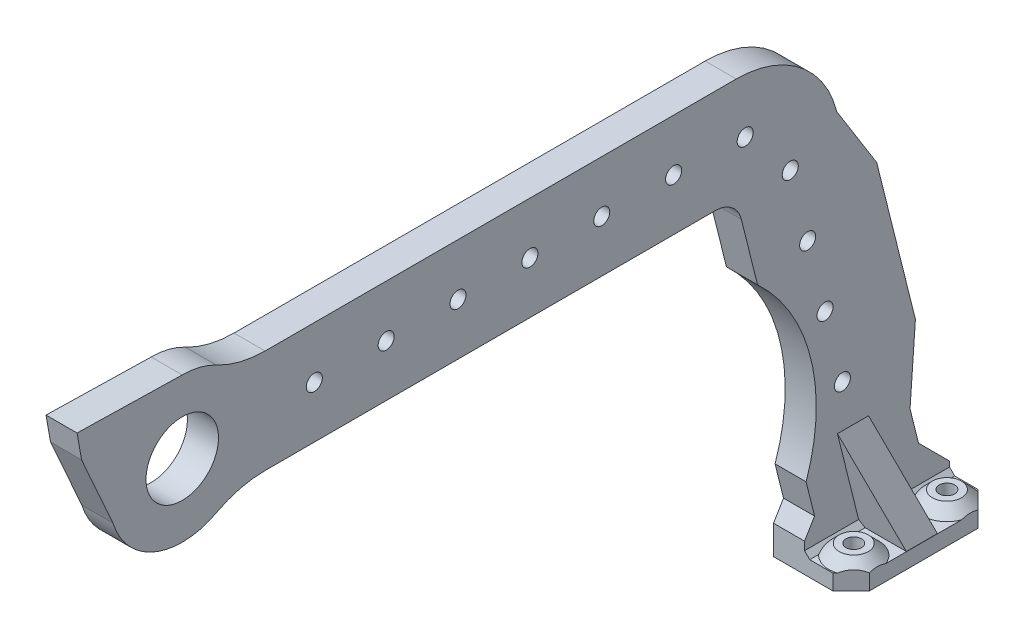
from build123d import *

# Parameters (mm, degrees)
SKETCH_1_R                = 7
EXTRUDE_1_DEPTH           = 3
SKETCH_5_W                = 15
SKETCH_5_H                = 28
EXTRUDE_3_DEPTH           = 3
SKETCH_6_R                = 1.5
CUT_EXTRUDE_2_DEPTH       = 175.055428478
CHAMFER_1_SIZE            = 3.5
SKETCH_10_R               = 1.55
CUT_EXTRUDE_3_DEPTH       = 10
PATTERN_START             = -3
PATTERN_CURVE_1_OUTLINE_R = 1.55
PATTERN_CURVE_1_DEPTH     = 6
EXTRUDE_4_DEPTH           = 6
EXTRUDE_5_DEPTH           = 3
CHAMFER_2_SIZE            = 1
CHAMFER_3_SIZE            = 4.949606318
CHAMFER_3_SIZE_2          = 6
CHAMFER_3_SIZE_3          = 8.237528241
EXTRUDE_START             = 2
SKETCH_17_R               = 2.8
SKETCH_17_R_2             = 1.5
EXTRUDE_1_2_DEPTH         = 2
CHAMFER_4_SIZE            = 2
SKETCH1_R                 = 35.5
CUT_EXTRUDE1_DEPTH        = 10
BOSS_EXTRUDE1_DEPTH       = 6


# Read off the part's stored shape, not the designer's step: 曲线阵列1
with BuildPart() as part:
    # 草图1 → Extrude 1 (new, symmetric)
    with BuildSketch(Plane(origin=(0, 0, 0), x_dir=(0, 0, -1), z_dir=(1, 0, 0))):
        with BuildLine():
            ThreePointArc((102.937314742, -10), (106.138754414, -11.102344081), (107.982852519, -13.942006143))
            Line((107.982852519, -13.942006143), (123.580312189, -76.5))
            Line((123.580312189, -76.5), (144.192584776, -76.5))
            Line((144.192584776, -76.5), (126.405914526, -5.161562088))
            ThreePointArc((126.405914526, -5.161562088), (119.313229507, 5.760215072), (107, 10))
            Line((107, 10), (16, 10))
            ThreePointArc((16, 10), (11.149287499, 10.597149997), (6.588235294, 12.352941176))
            ThreePointArc((6.588235294, 12.352941176), (3.395498751, 13.581995002), (0, 14))
            Line((0, 14), (-18, 14))
            Line((-18, 14), (-18, 11))
            Line((-18, 11), (-13.388941598, -4.090995342))
            ThreePointArc((-13.388941598, -4.090995342), (-5.350452205, -12.937258643), (6.588235294, -12.352941176))
            ThreePointArc((6.588235294, -12.352941176), (11.149287499, -10.597149997), (16, -10))
            Line((16, -10), (102.937314742, -10))
        make_face()
        Circle(SKETCH_1_R, mode=Mode.SUBTRACT)
    extrude(amount=EXTRUDE_1_DEPTH, both=True)

    # 草图5 → 凸台-拉伸3 (add)
    with BuildSketch(Plane.XZ.offset(76.5)):
        with Locations((4.5, -134.192584776)):
            Rectangle(SKETCH_5_W, SKETCH_5_H)
    extrude(amount=EXTRUDE_3_DEPTH)

    # 草图6 → 切除-拉伸2 (cut, through all)
    with BuildSketch(Plane(origin=(0, -76.5, 0), x_dir=(1, 0, 0), z_dir=(0, 1, 0))):
        with Locations(Location((7.5, 143.192584776, 0), (0, 0, 270))):
            Circle(SKETCH_6_R)
        with Locations(Location((7.5, 125.192584776, 0), (0, 0, 90))):
            Circle(SKETCH_6_R)
    extrude(amount=-CUT_EXTRUDE_2_DEPTH, mode=Mode.SUBTRACT)

    # 倒角1
    chamfer_1_edges = [part.edges().sort_by_distance(p)[0] for p in [
        (12, -78, -148.192584776),
        (12, -78, -120.192584776),
    ]]
    chamfer(chamfer_1_edges, length=CHAMFER_1_SIZE)

    # 草图10 → 切除-拉伸3 (cut)
    with BuildSketch(Plane.ZY.offset(3)):
        with Locations((-25.5, 0)):
            Circle(SKETCH_10_R)
    extrude(amount=-CUT_EXTRUDE_3_DEPTH, mode=Mode.SUBTRACT)

    # 曲线阵列1 outline → 曲线阵列1 (cut)
    with BuildSketch(Plane.YZ.offset(PATTERN_START)):
        with Locations((-50.909555093, -127.506033962)):
            Circle(PATTERN_CURVE_1_OUTLINE_R)
        with Locations((-37.441286405, -124.148017428)):
            Circle(PATTERN_CURVE_1_OUTLINE_R)
        with Locations((-23.973017717, -120.790000895)):
            Circle(PATTERN_CURVE_1_OUTLINE_R)
        with Locations((-10.504749029, -117.431984361)):
            Circle(PATTERN_CURVE_1_OUTLINE_R)
        with Locations((-0.573099264, -108.725472335)):
            Circle(PATTERN_CURVE_1_OUTLINE_R)
        with Locations((0, -94.902906369)):
            Circle(PATTERN_CURVE_1_OUTLINE_R)
        with Locations((0, -81.022325095)):
            Circle(PATTERN_CURVE_1_OUTLINE_R)
        with Locations((0, -67.141743821)):
            Circle(PATTERN_CURVE_1_OUTLINE_R)
        with Locations((0, -53.261162547)):
            Circle(PATTERN_CURVE_1_OUTLINE_R)
        with Locations((0, -39.380581274)):
            Circle(PATTERN_CURVE_1_OUTLINE_R)
    extrude(amount=PATTERN_CURVE_1_DEPTH, mode=Mode.SUBTRACT)

    # 草图15 → 凸台-拉伸4 (add)
    with BuildSketch(Plane(origin=(3, 0, 0), x_dir=(0, 0, -1), z_dir=(1, 0, 0))):
        Polygon((-20.316390831, 14.441494507), (-19.448149943, 9.517455742), (-13.388941598, -4.090995342), (-18, 11), (-18, 14), (0, 14), align=None)
    extrude(amount=-EXTRUDE_4_DEPTH)

    # 草图16 → 凸台-拉伸5 (add, symmetric, along a direction that is not the sketch's normal)
    with BuildSketch(Plane(origin=(0, 26.950685529, -108.093295667), x_dir=(-1, 0, 0), z_dir=(0, 0.2419218955996646, -0.9702957262759974))):
        Polygon((-12, -106.691747545), (-3, -88.691747545), (-3, -106.691747545), align=None)
    extrude(amount=EXTRUDE_5_DEPTH, dir=(0, 0, -1), both=True)

    # 倒角2
    chamfer_2_edges = [part.edges().sort_by_distance(p)[0] for p in [
        (3, -76.5, -140.539516629),
        (3, -76.5, -127.233380336),
    ]]
    chamfer(chamfer_2_edges, length=CHAMFER_2_SIZE)

    # 倒角3
    # the kernel refuses this chamfer: 8.237528241, 6, 4.949606318 mm, written as the material it adds along each edge
    with BuildSketch(Plane(origin=(19.430097928, -76.5, -123.580312189), x_dir=(0, -0.04051695164362419, 0.9991788511720553), z_dir=(-1, 0, 0))) as chamfer_3_piece_1_section:
        Polygon((CHAMFER_3_SIZE * 0.999178851168, CHAMFER_3_SIZE * 0.0405169516434), (CHAMFER_3_SIZE_2 * 0.202409816697, CHAMFER_3_SIZE_2 * 0.979300906823), (0, 0), align=None)
    chamfer_3_piece_1 = extrude(amount=22.430097928, mode=Mode.PRIVATE)
    chamfer_3_piece_1 = split(chamfer_3_piece_1, bisect_by=Plane(origin=(3, -73.046454267, -121.751433379), z_dir=(-1, 0, 0)), keep=Keep.TOP, mode=Mode.PRIVATE)
    chamfer_3_piece_1 = split(chamfer_3_piece_1, bisect_by=Plane(origin=(1.773227133, -73.046454267, -120.192584776), z_dir=(0, 0, -1)), keep=Keep.TOP, mode=Mode.PRIVATE)
    add(chamfer_3_piece_1)
    with BuildSketch(Plane(origin=(19.430097928, -76.5, -123.580312189), x_dir=(0, -0.04051695164362419, 0.9991788511720553), z_dir=(-1, 0, 0))) as chamfer_3_piece_2_section:
        Polygon((CHAMFER_3_SIZE * 0.999178851168, CHAMFER_3_SIZE * 0.0405169516434), (CHAMFER_3_SIZE_2 * 0.202409816697, CHAMFER_3_SIZE_2 * 0.979300906823), (0, 0), align=None)
    chamfer_3_piece_2 = extrude(amount=22.430097928, mode=Mode.PRIVATE)
    chamfer_3_piece_2 = split(chamfer_3_piece_2, bisect_by=Plane(origin=(3.335429121, -76.170858242, -120.192584776), z_dir=(0, 0, -1)), keep=Keep.TOP, mode=Mode.PRIVATE)
    chamfer_3_piece_2 = split(chamfer_3_piece_2, bisect_by=Plane(origin=(3.503143682, -76.003143682, -121.845416354), z_dir=(-0.7071067811865476, -0.7071067811865476, 0)), keep=Keep.TOP, mode=Mode.PRIVATE)
    add(chamfer_3_piece_2)
    with BuildSketch(Plane(origin=(-3, -76.5, -144.192584776), x_dir=(4.057410477830116e-15, -0.037354428652640735, -0.9993020797837033), z_dir=(1, 0, 0))) as chamfer_3_piece_3_section:
        Polygon((CHAMFER_3_SIZE_2 * 0.999302079784, CHAMFER_3_SIZE_2 * 0.0373544286526), (-CHAMFER_3_SIZE_3 * 0.277997895888, CHAMFER_3_SIZE_3 * 0.960581683052), (0, 0), align=None)
    chamfer_3_piece_3 = extrude(amount=28.304139536, mode=Mode.PRIVATE)
    chamfer_3_piece_3 = split(chamfer_3_piece_3, bisect_by=Plane(origin=(0.670769547, -73.170769547, -145.630202159), z_dir=(-0.7071067811865476, -0.7071067811865476, 0)), keep=Keep.TOP, mode=Mode.PRIVATE)
    chamfer_3_piece_3 = split(chamfer_3_piece_3, bisect_by=Plane(origin=(-0.598503723, -74.440042816, -148.192584776), z_dir=(0, 0, 1)), keep=Keep.TOP, mode=Mode.PRIVATE)
    add(chamfer_3_piece_3)
    with BuildSketch(Plane(origin=(-3, -76.5, -144.192584776), x_dir=(4.057410477830116e-15, -0.037354428652640735, -0.9993020797837033), z_dir=(1, 0, 0))) as chamfer_3_piece_4_section:
        Polygon((CHAMFER_3_SIZE_2 * 0.999302079784, CHAMFER_3_SIZE_2 * 0.0373544286526), (-CHAMFER_3_SIZE_3 * 0.277997895888, CHAMFER_3_SIZE_3 * 0.960581683052), (0, 0), align=None)
    chamfer_3_piece_4 = extrude(amount=28.304139536, mode=Mode.PRIVATE)
    chamfer_3_piece_4 = split(chamfer_3_piece_4, bisect_by=Plane(origin=(3, -72.000472632, -144.373314083), z_dir=(-1, 0, 0)), keep=Keep.TOP, mode=Mode.PRIVATE)
    chamfer_3_piece_4 = split(chamfer_3_piece_4, bisect_by=Plane(origin=(1.258880845, -72.000472632, -148.192584776), z_dir=(0, 0, 1)), keep=Keep.TOP, mode=Mode.PRIVATE)
    add(chamfer_3_piece_4)

    # 草图17 → Extrude 1 2 (add)
    # profile 1 of 2: a face of its own
    with BuildSketch(Plane(origin=(0, -76.5, 0), x_dir=(1, 0, 0), z_dir=(0, 1, 0)).offset(EXTRUDE_START)):
        with Locations((7.5, 125.192584776)):
            Circle(SKETCH_17_R)
        with Locations((7.5, 125.192584776)):
            Circle(SKETCH_17_R_2, mode=Mode.SUBTRACT)
    # profile 2 of 2: a face of its own
    with BuildSketch(Plane(origin=(0, -76.5, 0), x_dir=(1, 0, 0), z_dir=(0, 1, 0)).offset(EXTRUDE_START)):
        with Locations((7.5, 143.192584776)):
            Circle(SKETCH_17_R)
        with Locations((7.5, 143.192584776)):
            Circle(SKETCH_17_R_2, mode=Mode.SUBTRACT)
    extrude(amount=-EXTRUDE_1_2_DEPTH)

    # 倒角4
    # the kernel refuses this chamfer: 2 mm, written as the material it adds along each edge
    with BuildSketch(Plane(origin=(7.5, -76.5, -125.192584776), x_dir=(1, 0, 0), z_dir=(0, 0, 1))) as chamfer_4_piece_1_section:
        Polygon((2.8 + CHAMFER_4_SIZE, 0), (2.8, CHAMFER_4_SIZE), (2.8, 0), align=None)
    chamfer_4_piece_1 = revolve(axis=Axis((7.5, -76.5, -125.192584776), (0, 1, 0)), mode=Mode.PRIVATE)
    chamfer_4_piece_1 = split(chamfer_4_piece_1, bisect_by=Plane(origin=(8.598627061, -75.553822664, -120.291211837), z_dir=(-0.7071067811865476, 0, -0.7071067811865476)), keep=Keep.TOP, mode=Mode.PRIVATE)
    chamfer_4_piece_1 = split(chamfer_4_piece_1, bisect_by=Plane(origin=(12, -75.553822664, -125.192584776), z_dir=(-1, 0, 0)), keep=Keep.TOP, mode=Mode.PRIVATE)
    chamfer_4_piece_1 = split(chamfer_4_piece_1, bisect_by=Plane(origin=(3.697254122, -74.5, -125.192584776), z_dir=(0, -1, 0)), keep=Keep.TOP, mode=Mode.PRIVATE)
    add(chamfer_4_piece_1)
    with BuildSketch(Plane(origin=(7.5, -76.5, -143.192584776), x_dir=(1, 0, 0), z_dir=(0, 0, 1))) as chamfer_4_piece_2_section:
        Polygon((2.8 + CHAMFER_4_SIZE, 0), (2.8, CHAMFER_4_SIZE), (2.8, 0), align=None)
    chamfer_4_piece_2 = revolve(axis=Axis((7.5, -76.5, -143.192584776), (0, 1, 0)), mode=Mode.PRIVATE)
    chamfer_4_piece_2 = split(chamfer_4_piece_2, bisect_by=Plane(origin=(8.598627061, -75.553822664, -148.093957715), z_dir=(-0.7071067811865476, 0, 0.7071067811865476)), keep=Keep.TOP, mode=Mode.PRIVATE)
    chamfer_4_piece_2 = split(chamfer_4_piece_2, bisect_by=Plane(origin=(12, -75.553822664, -143.192584776), z_dir=(-1, 0, 0)), keep=Keep.TOP, mode=Mode.PRIVATE)
    chamfer_4_piece_2 = split(chamfer_4_piece_2, bisect_by=Plane(origin=(3.697254121, -74.5, -143.192584776), z_dir=(0, -1, 0)), keep=Keep.TOP, mode=Mode.PRIVATE)
    add(chamfer_4_piece_2)

    # Sketch1 → Cut-Extrude1 (cut)
    with BuildSketch(Plane(origin=(3, 0, 0), x_dir=(0, 0, -1), z_dir=(1, 0, 0))):
        with Locations((86.954808596, -52.5)):
            Circle(SKETCH1_R)
    extrude(amount=-CUT_EXTRUDE1_DEPTH, mode=Mode.SUBTRACT)

    # Sketch2 → Boss-Extrude1 (add)
    with BuildSketch(Plane(origin=(3, 0, 0), x_dir=(0, 0, -1), z_dir=(1, 0, 0))):
        Polygon((126.405914526, -5.161562088), (134.122760953, -17.511097881), (141.602601038, -47.511097881), (140.567007759, -61.958604825), align=None)
    extrude(amount=-BOSS_EXTRUDE1_DEPTH)


solid = part.part
